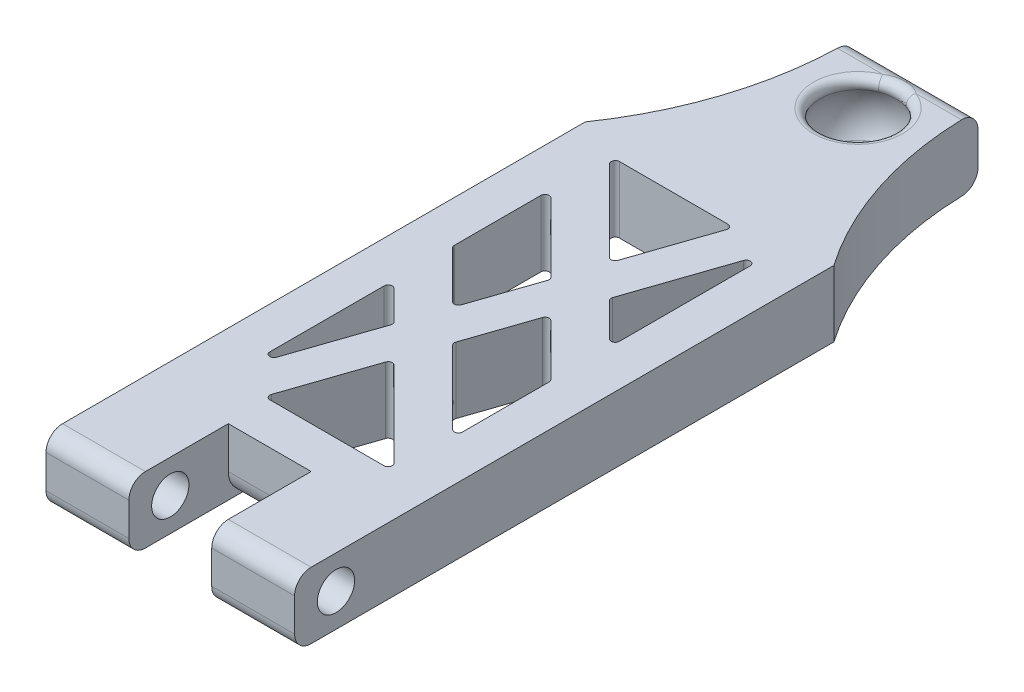
from build123d import *

# Parameters (mm, degrees)
SKETCH1_W               = 30
SKETCH1_H               = 90
BOSS_EXTRUDE1_DEPTH     = 8
SKETCH2_W               = 10
SKETCH2_H               = 12
CUT_EXTRUDE1_DEPTH      = 8
SKETCH3_R               = 2.25
CUT_EXTRUDE2_DEPTH      = 55.671747731
FILLET1_R               = 2
CUT_EXTRUDE3_DEPTH      = 49.104053883
FILLET2_R               = 3
FILLET3_R               = 0.9
CUT_EXTRUDE4_DEPTH      = 49.104054025
CUT_EXTRUDE4_DEPTH_BACK = 49.104054025
FILLET4_R               = 0.5


with BuildPart() as part:
    # Sketch1 → Boss-Extrude1 (new body)
    with BuildSketch(Plane(origin=(0, 0, 0), x_dir=(1, 0, 0), z_dir=(0, 1, 0))):
        Rectangle(SKETCH1_W, SKETCH1_H)
    extrude(amount=BOSS_EXTRUDE1_DEPTH)

    # Sketch2 → Cut-Extrude1 (cut)
    with BuildSketch(Plane(origin=(0, 8, 0), x_dir=(1, 0, 0), z_dir=(0, 1, 0))):
        with Locations((0, -39)):
            Rectangle(SKETCH2_W, SKETCH2_H)
    extrude(amount=-CUT_EXTRUDE1_DEPTH, mode=Mode.SUBTRACT)

    # Sketch3 → Cut-Extrude2 (cut, through all)
    with BuildSketch(Plane(origin=(15, 0, 0), x_dir=(0, 0, -1), z_dir=(1, 0, 0))):
        with Locations((-40, 4)):
            Circle(SKETCH3_R)
    extrude(amount=-CUT_EXTRUDE2_DEPTH, mode=Mode.SUBTRACT)

    # Fillet1
    fillet1_edges = [part.edges().sort_by_distance(p)[0] for p in [
        (10, 0, 45),
        (-10, 8, 45),
        (10, 8, 45),
        (-10, 0, 45),
        (0, 0, -45),
        (0, 8, -45),
    ]]
    fillet(fillet1_edges, radius=FILLET1_R)

    # Sketch4 → Cut-Extrude3 (cut, through all)
    with BuildSketch(Plane(origin=(0, 8, 0), x_dir=(1, 0, 0), z_dir=(0, 1, 0))):
        Polygon((5, 18), (-10, 18), (1.186440678, 6.813559322), align=None)
        Polygon((10, -2), (10, 18), (4.915254237, 3.084745763), align=None)
        Polygon((-10, -8), (-10, -26), (-5.423728814, -12.576271186), align=None)
        Polygon((-5.681818182, -28), (10, -28), (-1.694915254, -16.305084746), align=None)
        Polygon((-10, 10.928932188), (-10, -0.928932188), (-3.625999709, -7.302932479), (-0.611288427, 1.540220615), align=None)
        Polygon((10.002308787, -20.931240975), (10.002308787, -9.073376599), (3.117525133, -2.188592944), (0.10281385, -11.031746039), align=None)
    extrude(amount=-CUT_EXTRUDE3_DEPTH, mode=Mode.SUBTRACT)

    # Fillet2
    fillet2_edges = [part.edges().sort_by_distance(p)[0] for p in [
        (0, 0, 33),
    ]]
    fillet(fillet2_edges, radius=FILLET2_R)

    # Sketch5 → Cut-Revolve1 (revolve, cut)
    with BuildSketch(Plane(origin=(0, 0, 0), x_dir=(0, 0, -1), z_dir=(1, 0, 0))):
        with BuildLine():
            Line((41.5, 8), (38, 8))
            Line((38, 8), (38, 0))
            Line((38, 0), (41.5, 0))
            ThreePointArc((41.5, 0), (43.315072906, 4), (41.5, 8))
        make_face()
    revolve(axis=Axis((0, 8, -38), (0, -1, 0)), mode=Mode.SUBTRACT)

    # Fillet3
    fillet3_edges = [part.edges().sort_by_distance(p)[0] for p in [
        (0, 0, -34.5),
        (0, 8, -34.5),
    ]]
    fillet(fillet3_edges, radius=FILLET3_R - 0.0004)  # a hair under: the kernel refuses the full size

    # Sketch6 → Cut-Extrude4 (cut, two sides: drawn at the far end of the back side and taken through both)
    with BuildSketch(Plane(origin=(0, 8, 0), x_dir=(1, 0, 0), z_dir=(0, 1, 0)).offset(-CUT_EXTRUDE4_DEPTH_BACK)):
        with BuildLine():
            Line((-7.477541934, 45), (-15, 45))
            Line((-15, 45), (-15, 20.080818258))
            ThreePointArc((-15, 20.080818258), (-9.275408523, 31.947720661), (-7.477541934, 45))
        make_face()
        with BuildLine():
            Line((15, 45), (15, 20.080818258))
            ThreePointArc((15, 20.080818258), (9.275408523, 31.947720661), (7.477541934, 45))
            Line((7.477541934, 45), (15, 45))
        make_face()
    extrude(amount=CUT_EXTRUDE4_DEPTH + CUT_EXTRUDE4_DEPTH_BACK, mode=Mode.SUBTRACT)

    # Fillet4
    fillet4_edges = [part.edges().sort_by_distance(p)[0] for p in [
        (-10, 4, -10.928932188),
        (-0.611288427, 4, -1.540220615),
        (-3.625999709, 4, 7.302932479),
        (-10, 4, 0.928932188),
        (-1.694915254, 4, 16.305084746),
        (10, 4, 28),
        (-5.681818182, 4, 28),
        (10, 4, 2),
        (4.915254237, 4, -3.084745763),
        (10, 4, -18),
        (-10, 4, 8),
        (-5.423728814, 4, 12.576271186),
        (-10, 4, 26),
        (10.002308787, 4, 20.931240975),
        (0.10281385, 4, 11.031746039),
        (3.117525133, 4, 2.188592944),
        (10.002308787, 4, 9.073376599),
        (5, 4, -18),
        (1.186440678, 4, -6.813559322),
        (-10, 4, -18),
    ]]
    fillet(fillet4_edges, radius=FILLET4_R)


solid = part.part
